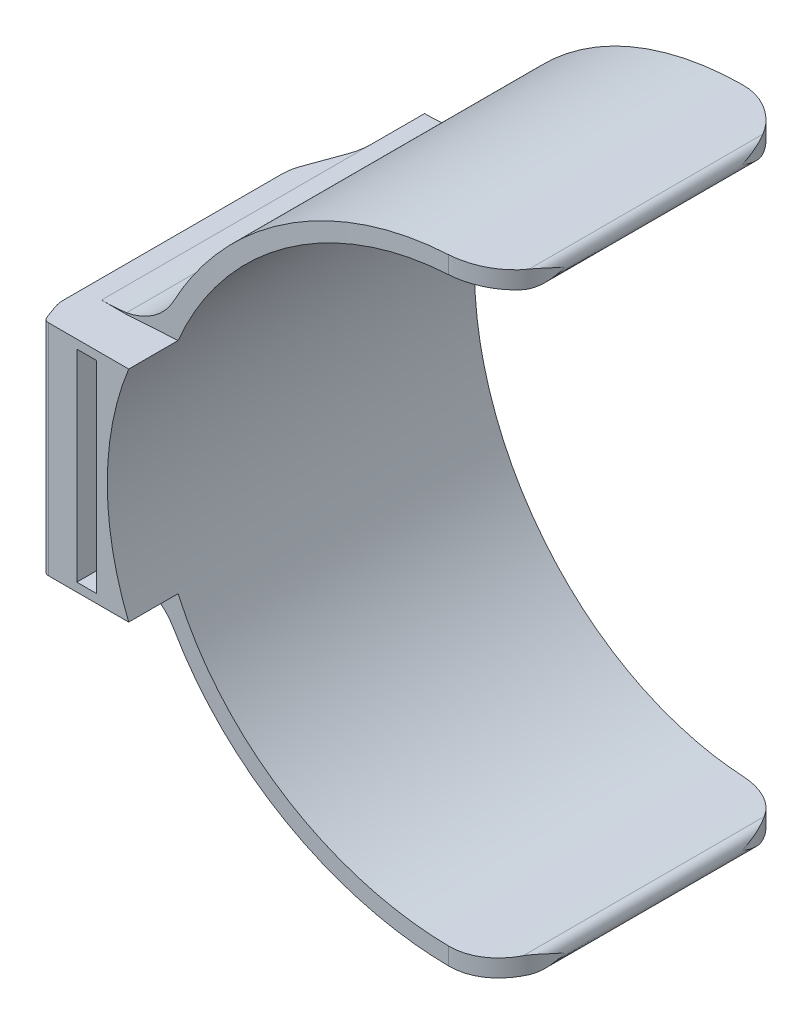
from build123d import *

# Parameters (mm, degrees)
BOSS_EXTRUDE1_DEPTH = 28
BOSS_EXTRUDE3_DEPTH = 28
CUT_EXTRUDE1_REACH  = 130.587
BOSS_EXTRUDE4_DEPTH = 53
CUT_EXTRUDE2_REACH  = 104.644
FILLET1_R           = 10
FILLET2_R           = 1
SKETCH8_W           = 3.3999999999999995
SKETCH8_H           = 35
CUT_EXTRUDE3_DEPTH  = 35


with BuildPart() as part:
    # Sketch3 → Boss-Extrude1 (new, symmetric)
    with BuildSketch(Plane.XY):
        Polygon((-4.5000000000000036, 19.000000000000004), (4.4999999999999964, 19.000000000000004), (4.500000000000002, -18.999999999999996), (-4.499999999999998, -18.999999999999996), align=None)
    extrude(amount=BOSS_EXTRUDE1_DEPTH, both=True)

    # Sketch4 → Boss-Extrude3 (add, symmetric)
    with BuildSketch(Plane.XY):
        with BuildLine():
            Line((-4.5000000000000036, 19.000000000000004), (-4.499999999999998, -18.999999999999996))
            ThreePointArc((-4.499999999999998, -19), (-2.3322984825233597, -19.065864592910174), (-0.17259464036850503, -19.263215366030792))
            ThreePointArc((-0.17259464036850614, -19.26321536603079), (4.319825650204091, -20.976129337924185), (7.493612362826209, -24.58763764402557))
            ThreePointArc((7.493612362826198, -24.587637644025573), (30.211154009544185, -47.368063912418876), (61.890850582710044, -52.97443033571058))
            ThreePointArc((61.890850582710044, -52.97443033571057), (63.182640459210326, -51.291789876500275), (61.50000000000002, -50))
            ThreePointArc((61.50000000000002, -50), (4.499999999999993, -8.88e-15), (61.500000000000014, 49.999999999999986))
            ThreePointArc((61.500000000000014, 50.00000000000001), (63.182640459210326, 51.29178987650027), (61.89085058271005, 52.97443033571058))
            ThreePointArc((61.89085058271005, 52.97443033571057), (30.21115400954418, 47.3680639124189), (7.493612362826205, 24.587637644025563))
            ThreePointArc((7.493612362826209, 24.58763764402557), (4.319825650204091, 20.976129337924185), (-0.17259464036850614, 19.26321536603079))
            ThreePointArc((-0.17259464036850503, 19.263215366030785), (-2.332298482523363, 19.06586459291018), (-4.5000000000000036, 19))
        make_face()
    extrude(amount=BOSS_EXTRUDE3_DEPTH, both=True)

    # Sketch5 → Cut-Extrude1 (cut, up to next)
    with BuildSketch(Plane(origin=(0, 55, 0), x_dir=(1, 0, 0), z_dir=(0, 1, 0)), mode=Mode.PRIVATE) as cut_extrude1_sk1:
        with BuildLine():
            Line((63.195425291355036, 28), (-0.17259464036850722, 28))
            ThreePointArc((-0.17259464036850147, 28), (26.49647760895955, 26.431121458517964), (53.19542529135502, 25.5))
            ThreePointArc((53.19542529135502, 25.499999999999996), (60.18953674939822, 22.51472135489191), (63.19542529135502, 15.529442709783872))
            Line((63.19542529135502, 15.529442709783872), (63.195425291355036, 28))
        make_face()
    cut_extrude1_tool1 = extrude(cut_extrude1_sk1.sketch, amount=-CUT_EXTRUDE1_REACH, mode=Mode.PRIVATE) & part.part
    # Sketch5 → Cut-Extrude1 (cut, up to next)
    with BuildSketch(Plane(origin=(0, 55, 0), x_dir=(1, 0, 0), z_dir=(0, 1, 0)), mode=Mode.PRIVATE) as cut_extrude1_sk2:
        with BuildLine():
            ThreePointArc((53.19542529135502, -25.5), (26.49647760895955, -26.431121458517964), (-0.17259464036850147, -28))
            Line((-0.17259464036850722, -28), (63.195425291355036, -28))
            Line((63.195425291355036, -28), (63.19542529135502, -15.500000000000117))
            ThreePointArc((63.195425291355015, -15.500000000000117), (60.19542529135497, -22.500000000000032), (53.19542529135502, -25.5))
        make_face()
    cut_extrude1_tool2 = extrude(cut_extrude1_sk2.sketch, amount=-CUT_EXTRUDE1_REACH, mode=Mode.PRIVATE) & part.part
    add(cut_extrude1_tool1.solids().sort_by_distance((43.697502, 55, -26.328525))[0], mode=Mode.SUBTRACT)
    add(cut_extrude1_tool2.solids().sort_by_distance((43.706075, 55, 26.326195))[0], mode=Mode.SUBTRACT)

    # Sketch6 → Boss-Extrude4 (add)
    with BuildSketch(Plane.XY.offset(36.00000000000001)):
        with BuildLine():
            Line((-4.5000000000000036, 19.000000000000004), (8.216151988012996, 19.000000000000004))
            ThreePointArc((8.216151988012996, 19.000000000000004), (4.500000000000021, 2.99e-15), (8.216151988012982, -18.999999999999975))
            Line((8.216151988012982, -18.999999999999975), (-4.500000000000135, -18.999999999999975))
            Line((-4.500000000000135, -18.999999999999975), (-7.7838480119869935, -18.999999999999996))
            Line((-7.7838480119869935, -18.999999999999996), (-7.783848011986998, 19.000000000000004))
            Line((-7.783848011986998, 19.000000000000004), (-4.5000000000000036, 19.000000000000004))
        make_face()
    extrude(amount=-BOSS_EXTRUDE4_DEPTH)

    # Sketch7 → Cut-Extrude2 (cut, up to next)
    with BuildSketch(Plane.XZ.offset(18.999999999999975), mode=Mode.PRIVATE) as cut_extrude2_sk1:
        with BuildLine():
            Line((-4.801536896070472, -16.171534186913952), (-4.500000000000001, -16.999999999999993))
            Line((-4.500000000000001, -16.999999999999993), (-7.7838480119869935, -16.999999999999993))
            Line((-7.7838480119869935, -16.999999999999993), (-7.783848011986993, -6.567085892477136))
            ThreePointArc((-7.783848011986993, -6.567085892477136), (-7.662310036084654, -7.9562713138126275), (-7.301388978274239, -9.303247039082573))
            Line((-7.301388978274239, -9.303247039082573), (-4.801536896070472, -16.171534186913952))
        make_face()
    cut_extrude2_tool1 = extrude(cut_extrude2_sk1.sketch, amount=-CUT_EXTRUDE2_REACH, mode=Mode.PRIVATE) & part.part
    # Sketch7 → Cut-Extrude2 (cut, up to next)
    with BuildSketch(Plane.XZ.offset(18.999999999999975), mode=Mode.PRIVATE) as cut_extrude2_sk2:
        with BuildLine():
            Line((-7.482311115916535, 33.039076242949854), (-6.4046230024186395, 36.00000000000001))
            Line((-6.4046230024186395, 36.00000000000001), (-7.7838480119869935, 36.00000000000001))
            Line((-7.7838480119869935, 36.00000000000001), (-7.7838480119869935, 31.32897552632149))
            ThreePointArc((-7.7838480119869935, 31.32897552632149), (-7.707886777048033, 32.197216414656154), (-7.482311115916535, 33.039076242949854))
        make_face()
    cut_extrude2_tool2 = extrude(cut_extrude2_sk2.sketch, amount=-CUT_EXTRUDE2_REACH, mode=Mode.PRIVATE) & part.part
    add(cut_extrude2_tool1.solids().sort_by_distance((-6.696905, -19, -13.946174))[0], mode=Mode.SUBTRACT)
    add(cut_extrude2_tool2.solids().sort_by_distance((-7.330841, -19, 34.694062))[0], mode=Mode.SUBTRACT)

    # Fillet1
    fillet1_edges = [part.edges().sort_by_distance(p)[0] for p in [
        (-4.500000000000001, 3.55e-15, -16.999999999999993),
    ]]
    fillet(fillet1_edges, radius=FILLET1_R)

    # Fillet2
    fillet2_edges = [part.edges().sort_by_distance(p)[0] for p in [
        (-6.4046230024186395, 1.421e-14, 36.00000000000001),
    ]]
    fillet(fillet2_edges, radius=FILLET2_R)

    # Sketch8 → Cut-Extrude3 (cut)
    with BuildSketch(Plane.XY.offset(36.00000000000001)):
        with Locations((0.9161519880130067, 3.55e-15)):
            Rectangle(SKETCH8_W, SKETCH8_H)
    extrude(amount=-CUT_EXTRUDE3_DEPTH, mode=Mode.SUBTRACT)


solid = part.part
